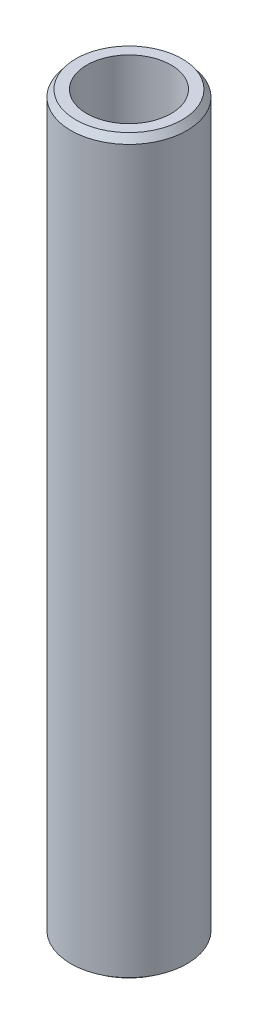
from build123d import *
from OCP.BRepFilletAPI import BRepFilletAPI_MakeChamfer

# Parameters (mm, degrees)
SKETCH1_R           = 47.5
BOSS_EXTRUDE1_DEPTH = 600
SKETCH2_R           = 34.479799293
CUT_EXTRUDE1_DEPTH  = 604.748706003
CHAMFER1_SIZE       = 5.478313216
CHAMFER1_SIZE2      = 4.099929806


with BuildPart() as part:
    # Sketch1 → Boss-Extrude1 (new body)
    with BuildSketch(Plane(origin=(0, 0, 0), x_dir=(1, 0, 0), z_dir=(0, 1, 0))):
        Circle(SKETCH1_R)
    extrude(amount=BOSS_EXTRUDE1_DEPTH)

    # Sketch2 → Cut-Extrude1 (cut, through all)
    with BuildSketch(Plane(origin=(0, 0, 0), x_dir=(1, 0, 0), z_dir=(0, 1, 0))):
        Circle(SKETCH2_R)
    extrude(amount=CUT_EXTRUDE1_DEPTH, mode=Mode.SUBTRACT)

    # Chamfer1: one chamfer whose edges measure the first distance from different faces: ONE call of the kernel's chamfer builder (chamfer() names one face for all edges)
    chamfer1_edges_1 = [part.edges().sort_by_distance(p)[0] for p in [
        (-47.5, 600, 0),
    ]]
    chamfer1_side_1 = [part.faces().sort_by_distance(p)[0] for p in [
        (-47.5, 300, 0),
    ]]
    chamfer1_edges_2 = [part.edges().sort_by_distance(p)[0] for p in [
        (-47.5, 0, 0),
    ]]
    chamfer1_side_2 = [part.faces().sort_by_distance(p)[0] for p in [
        (-46.156497116, 0, 0),
    ]]
    chamfer1 = BRepFilletAPI_MakeChamfer(part.part.solid().wrapped)
    for e in chamfer1_edges_1:
        chamfer1.Add(CHAMFER1_SIZE, CHAMFER1_SIZE2, e.wrapped, chamfer1_side_1[0].wrapped)  # the first distance lies on this face
    for e in chamfer1_edges_2:
        chamfer1.Add(CHAMFER1_SIZE, CHAMFER1_SIZE2, e.wrapped, chamfer1_side_2[0].wrapped)  # the first distance lies on this face
    add(Compound.cast(chamfer1.Shape()), mode=Mode.REPLACE)


solid = part.part
